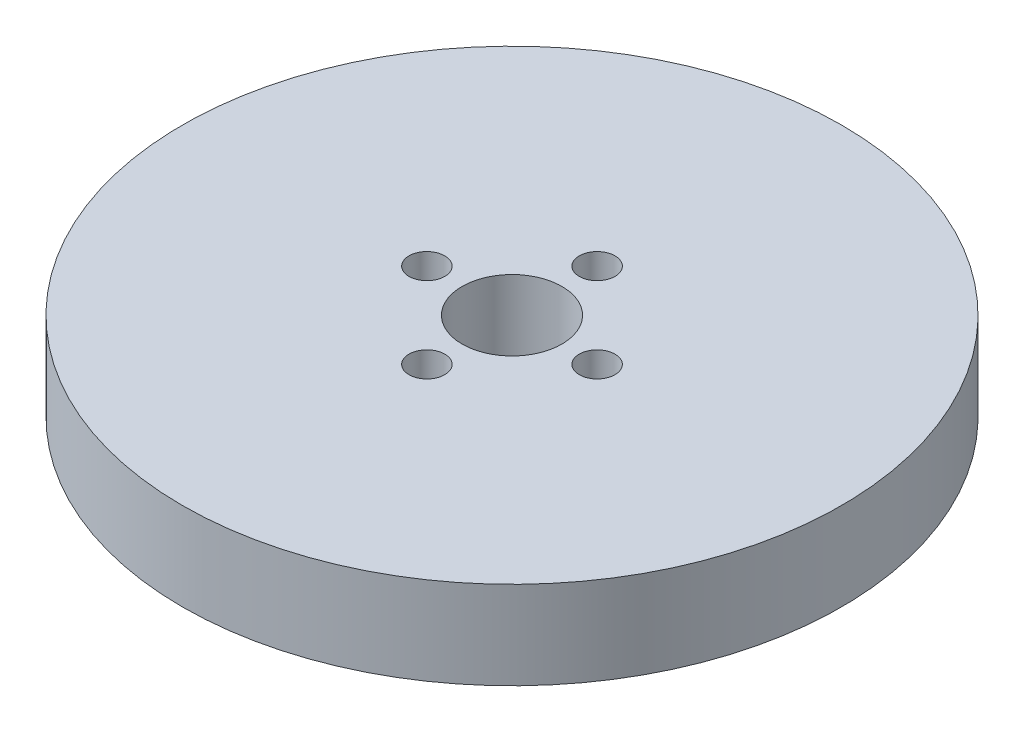
from build123d import *

# Parameters (mm, degrees)
SKETCH1_R           = 82.5
BOSS_EXTRUDE1_DEPTH = 22
SKETCH2_R           = 12.5
CUT_EXTRUDE1_DEPTH  = 119.728682297
SKETCH3_R           = 4.473192397
CUT_EXTRUDE2_DEPTH  = 13.79942972
CIRPATTERN1_COUNT   = 4


with BuildPart() as part:
    # Sketch1 → Boss-Extrude1 (new body)
    with BuildSketch(Plane(origin=(0, 0, 0), x_dir=(1, 0, 0), z_dir=(0, 1, 0))):
        Circle(SKETCH1_R)
    extrude(amount=BOSS_EXTRUDE1_DEPTH)

    # Sketch2 → Cut-Extrude1 (cut, through all)
    with BuildSketch(Plane(origin=(0, 0, 0), x_dir=(1, 0, 0), z_dir=(0, 1, 0))):
        Circle(SKETCH2_R)
    extrude(amount=CUT_EXTRUDE1_DEPTH, mode=Mode.SUBTRACT)

    # Sketch3 → Cut-Extrude2 (cut)
    with BuildSketch(Plane(origin=(0, 22, 0), x_dir=(1, 0, 0), z_dir=(0, 1, 0))):
        with Locations((-21.30709758, 0)):
            Circle(SKETCH3_R)
    cut_extrude2 = extrude(amount=-CUT_EXTRUDE2_DEPTH, mode=Mode.SUBTRACT)

    # CirPattern1: Cut-Extrude2 ×4 about axis
    cirpattern1_axis = Axis((0, 0, 0), (0, 1, 0))
    for i in range(1, CIRPATTERN1_COUNT):
        add(cut_extrude2.rotate(cirpattern1_axis, i * 360 / CIRPATTERN1_COUNT), mode=Mode.SUBTRACT)


solid = part.part
